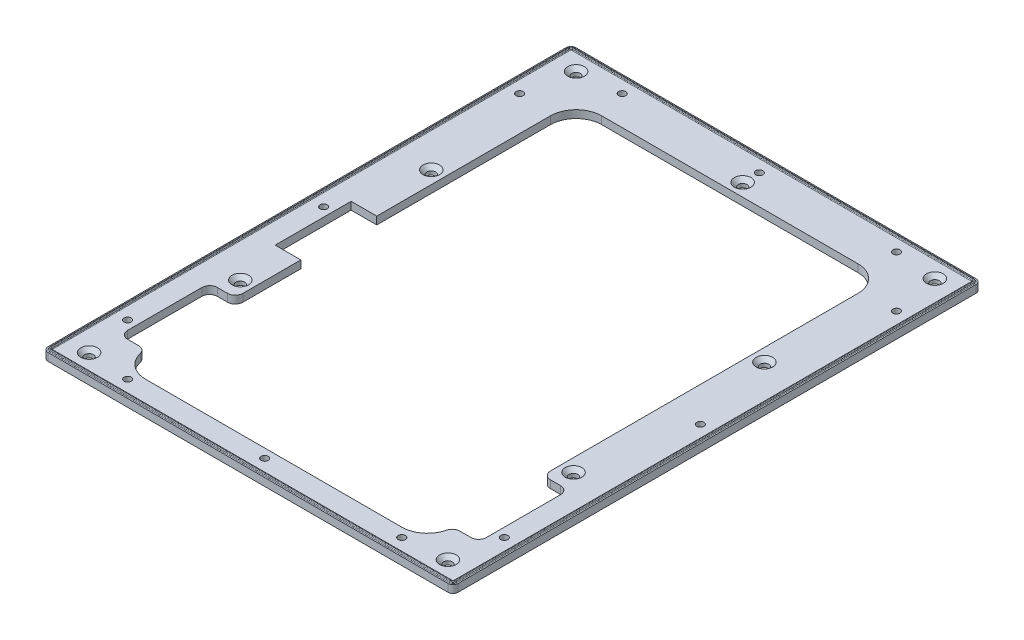
from build123d import *

# Parameters (mm, degrees)
BOSS_EXTRUDE1_DEPTH                            = 3
CSK_FOR_M3_FLAT_HEAD_MACHINE_SCREW1_AT_2_COUNT = 2
CSK_FOR_M3_FLAT_HEAD_MACHINE_SCREW1_AT_2_PITCH = 70.178344238
CSK_FOR_M3_FLAT_HEAD_MACHINE_SCREW1_AT_3_COUNT = 2
CSK_FOR_M3_FLAT_HEAD_MACHINE_SCREW1_AT_3_PITCH = 140
CSK_FOR_M3_FLAT_HEAD_MACHINE_SCREW1_AT_4_COUNT = 2
CSK_FOR_M3_FLAT_HEAD_MACHINE_SCREW1_AT_4_PITCH = 148.348407474
CSK_FOR_M3_FLAT_HEAD_MACHINE_SCREW1_AT_5_COUNT = 2
CSK_FOR_M3_FLAT_HEAD_MACHINE_SCREW1_AT_5_PITCH = 61.702917273
CSK_FOR_M3_FLAT_HEAD_MACHINE_SCREW1_AT_6_COUNT = 2
CSK_FOR_M3_FLAT_HEAD_MACHINE_SCREW1_AT_6_PITCH = 136.091880728
CSK_FOR_M3_FLAT_HEAD_MACHINE_SCREW1_AT_7_COUNT = 2
CSK_FOR_M3_FLAT_HEAD_MACHINE_SCREW1_AT_7_PITCH = 190
CSK_FOR_M3_FLAT_HEAD_MACHINE_SCREW1_AT_8_COUNT = 2
CSK_FOR_M3_FLAT_HEAD_MACHINE_SCREW1_AT_8_PITCH = 236.008474424
CSK_FOR_M3_FLAT_HEAD_MACHINE_SCREW1_AT_9_COUNT = 2
CSK_FOR_M3_FLAT_HEAD_MACHINE_SCREW1_AT_9_PITCH = 191.627242322
CUT_EXTRUDE8_DEPTH                             = 261.854365499
SKETCH15_W                                     = 10
SKETCH15_H                                     = 35
CUT_EXTRUDE9_DEPTH                             = 261.854365499
FILLET5_R                                      = 3
BOSS_EXTRUDE2_DEPTH                            = 0.5
FILLET6_R                                      = 0.25
F_3_0MM_DOWEL_HOLE1_D                          = 2.8
F_3_0MM_DOWEL_HOLE1_ON_FACE_2_D                = 2.8
F_3_0MM_DOWEL_HOLE1_ON_FACE_3_D                = 2.8
SKETCH22_W                                     = 10
SKETCH22_H                                     = 29.612304697
CUT_EXTRUDE10_DEPTH                            = 261.854365499


with BuildPart() as part:
    # Sketch1 → Boss-Extrude1 (new body)
    with BuildSketch(Plane(origin=(0, 0, 0), x_dir=(1, 0, 0), z_dir=(0, 1, 0))):
        with BuildLine():
            Line((2, 0), (158, 0))
            ThreePointArc((158, 0), (159.414213562, -0.585786438), (160, -2))
            Line((160, -2), (160, -204))
            ThreePointArc((160, -204), (159.414213562, -205.414213562), (158, -206))
            Line((158, -206), (2, -206))
            ThreePointArc((2, -206), (0.585786438, -205.414213562), (0, -204))
            Line((0, -204), (0, -2))
            ThreePointArc((0, -2), (0.585786438, -0.585786438), (2, 0))
        make_face()
    extrude(amount=BOSS_EXTRUDE1_DEPTH)

    # Sketch13 → CSK for M3 Flat Head Machine Screw1 (revolve, cut)
    with BuildSketch(Plane(origin=(10, 3, 8), x_dir=(0, 0, 1), z_dir=(1, 0, 0))):
        Polygon((0, 0), (0, 3), (1.7, 3), (1.7, 1.55), (3.25, 0), align=None)
    csk_for_m3_flat_head_machine_screw1 = revolve(axis=Axis((10, 9.35, 8), (0, -1, 0)), mode=Mode.SUBTRACT)

    # CSK for M3 Flat Head Machine Screw1 at 2: CSK for M3 Flat Head Machine Screw1 ×2
    with Locations(*[Vector(0.9974586998307351, 0, 0.07124704998790932) * (i * CSK_FOR_M3_FLAT_HEAD_MACHINE_SCREW1_AT_2_PITCH) for i in range(1, CSK_FOR_M3_FLAT_HEAD_MACHINE_SCREW1_AT_2_COUNT)]):
        add(csk_for_m3_flat_head_machine_screw1, mode=Mode.SUBTRACT)

    # CSK for M3 Flat Head Machine Screw1 at 3: CSK for M3 Flat Head Machine Screw1 ×2
    with Locations(*[(i * CSK_FOR_M3_FLAT_HEAD_MACHINE_SCREW1_AT_3_PITCH, 0, 0) for i in range(1, CSK_FOR_M3_FLAT_HEAD_MACHINE_SCREW1_AT_3_COUNT)]):
        add(csk_for_m3_flat_head_machine_screw1, mode=Mode.SUBTRACT)

    # CSK for M3 Flat Head Machine Screw1 at 4: CSK for M3 Flat Head Machine Screw1 ×2
    with Locations(*[Vector(0.9100198802193487, 0, 0.41456461209992634) * (i * CSK_FOR_M3_FLAT_HEAD_MACHINE_SCREW1_AT_4_PITCH) for i in range(1, CSK_FOR_M3_FLAT_HEAD_MACHINE_SCREW1_AT_4_COUNT)]):
        add(csk_for_m3_flat_head_machine_screw1, mode=Mode.SUBTRACT)

    # CSK for M3 Flat Head Machine Screw1 at 5: CSK for M3 Flat Head Machine Screw1 ×2
    with Locations(*[Vector(0.08103344575876159, 0, 0.9967113828327947) * (i * CSK_FOR_M3_FLAT_HEAD_MACHINE_SCREW1_AT_5_PITCH) for i in range(1, CSK_FOR_M3_FLAT_HEAD_MACHINE_SCREW1_AT_5_COUNT)]):
        add(csk_for_m3_flat_head_machine_screw1, mode=Mode.SUBTRACT)

    # CSK for M3 Flat Head Machine Screw1 at 6: CSK for M3 Flat Head Machine Screw1 ×2
    with Locations(*[Vector(0.036739884651930246, 0, 0.9993248625325815) * (i * CSK_FOR_M3_FLAT_HEAD_MACHINE_SCREW1_AT_6_PITCH) for i in range(1, CSK_FOR_M3_FLAT_HEAD_MACHINE_SCREW1_AT_6_COUNT)]):
        add(csk_for_m3_flat_head_machine_screw1, mode=Mode.SUBTRACT)

    # CSK for M3 Flat Head Machine Screw1 at 7: CSK for M3 Flat Head Machine Screw1 ×2
    with Locations(*[(0, 0, i * CSK_FOR_M3_FLAT_HEAD_MACHINE_SCREW1_AT_7_PITCH) for i in range(1, CSK_FOR_M3_FLAT_HEAD_MACHINE_SCREW1_AT_7_COUNT)]):
        add(csk_for_m3_flat_head_machine_screw1, mode=Mode.SUBTRACT)

    # CSK for M3 Flat Head Machine Screw1 at 8: CSK for M3 Flat Head Machine Screw1 ×2
    with Locations(*[Vector(0.5931990380498493, 0, 0.8050558373533686) * (i * CSK_FOR_M3_FLAT_HEAD_MACHINE_SCREW1_AT_8_PITCH) for i in range(1, CSK_FOR_M3_FLAT_HEAD_MACHINE_SCREW1_AT_8_COUNT)]):
        add(csk_for_m3_flat_head_machine_screw1, mode=Mode.SUBTRACT)

    # CSK for M3 Flat Head Machine Screw1 at 9: CSK for M3 Flat Head Machine Screw1 ×2
    with Locations(*[Vector(0.7044927347701055, 0, 0.7097111994721077) * (i * CSK_FOR_M3_FLAT_HEAD_MACHINE_SCREW1_AT_9_PITCH) for i in range(1, CSK_FOR_M3_FLAT_HEAD_MACHINE_SCREW1_AT_9_COUNT)]):
        add(csk_for_m3_flat_head_machine_screw1, mode=Mode.SUBTRACT)

    # Sketch14 → Cut-Extrude8 (cut, through all)
    with BuildSketch(Plane(origin=(0, 3, 0), x_dir=(1, 0, 0), z_dir=(0, 1, 0))):
        with BuildLine():
            Line((30, -18), (130, -18))
            ThreePointArc((130, -18), (137.071067812, -20.928932188), (140, -28))
            Line((140, -28), (140, -186))
            ThreePointArc((140, -186), (137.071067812, -193.071067812), (130, -196))
            Line((130, -196), (30, -196))
            ThreePointArc((30, -196), (22.928932188, -193.071067812), (20, -186))
            Line((20, -186), (20, -28))
            ThreePointArc((20, -28), (22.928932188, -20.928932188), (30, -18))
        make_face()
    extrude(amount=-CUT_EXTRUDE8_DEPTH, mode=Mode.SUBTRACT)

    # Sketch15 → Cut-Extrude9 (cut, through all)
    with BuildSketch(Plane(origin=(0, 3, 0), x_dir=(1, 0, 0), z_dir=(0, 1, 0))):
        with Locations((15, -168.5)):
            Rectangle(SKETCH15_W, SKETCH15_H)
        with Locations((145, -168.5)):
            Rectangle(SKETCH15_W, SKETCH15_H)
    extrude(amount=-CUT_EXTRUDE9_DEPTH, mode=Mode.SUBTRACT)

    # Fillet5
    fillet5_edges = [part.edges().sort_by_distance(p)[0] for p in [
        (20, 1.5, 186),
        (140, 1.5, 186),
        (20, 1.5, 151),
        (10, 1.5, 186),
        (10, 1.5, 151),
        (140, 1.5, 151),
        (150, 1.5, 151),
        (150, 1.5, 186),
    ]]
    fillet(fillet5_edges, radius=FILLET5_R)

    # Sketch18 → Boss-Extrude2 (add)
    with BuildSketch(Plane(origin=(0, 3, 0), x_dir=(1, 0, 0), z_dir=(0, 1, 0))):
        with BuildLine():
            Line((2, -205.25), (158, -205.25))
            ThreePointArc((158, -205.25), (158.883883476, -204.883883476), (159.25, -204))
            Line((159.25, -204), (159.25, -2))
            ThreePointArc((159.25, -2), (158.883883476, -1.116116524), (158, -0.75))
            Line((158, -0.75), (2, -0.75))
            ThreePointArc((2, -0.75), (1.116116524, -1.116116524), (0.75, -2))
            Line((0.75, -2), (0.75, -204))
            ThreePointArc((0.75, -204), (1.116116524, -204.883883476), (2, -205.25))
        make_face()
        with BuildLine():
            Line((2, -204.5), (158, -204.5))
            ThreePointArc((158, -204.5), (158.353553391, -204.353553391), (158.5, -204))
            Line((158.5, -204), (158.5, -2))
            ThreePointArc((158.5, -2), (158.353553391, -1.646446609), (158, -1.5))
            Line((158, -1.5), (2, -1.5))
            ThreePointArc((2, -1.5), (1.646446609, -1.646446609), (1.5, -2))
            Line((1.5, -2), (1.5, -204))
            ThreePointArc((1.5, -204), (1.646446609, -204.353553391), (2, -204.5))
        make_face(mode=Mode.SUBTRACT)
    extrude(amount=BOSS_EXTRUDE2_DEPTH)

    # Fillet6
    fillet6_edges = [part.edges().sort_by_distance(p)[0] for p in [
        (1.116116524, 3, 1.116116524),
        (80, 3, 0.75),
        (158.883883476, 3, 1.116116524),
        (159.25, 3, 103),
        (158.883883476, 3, 204.883883476),
        (80, 3, 205.25),
        (1.116116524, 3, 204.883883476),
        (158.353553391, 3, 1.646446609),
        (158.5, 3, 103),
        (158.353553391, 3, 204.353553391),
        (80, 3, 204.5),
        (1.646446609, 3, 204.353553391),
        (1.5, 3, 103),
        (1.646446609, 3, 1.646446609),
        (0.75, 3, 103),
        (80, 3, 1.5),
    ]]
    fillet(fillet6_edges, radius=FILLET6_R)
    fillet6_2_edges = [part.edges().sort_by_distance(p)[0] for p in [
        (80, 3.5, 1.5),
        (158.353553391, 3.5, 1.646446609),
        (158.5, 3.5, 103),
        (158.353553391, 3.5, 204.353553391),
        (80, 3.5, 204.5),
        (1.646446609, 3.5, 204.353553391),
        (1.5, 3.5, 103),
        (80, 3.5, 0.75),
        (158.883883476, 3.5, 1.116116524),
        (159.25, 3.5, 103),
        (158.883883476, 3.5, 204.883883476),
        (80, 3.5, 205.25),
        (1.116116524, 3.5, 204.883883476),
        (0.75, 3.5, 103),
        (1.646446609, 3.5, 1.646446609),
        (1.116116524, 3.5, 1.116116524),
    ]]
    fillet(fillet6_2_edges, radius=FILLET6_R - 0.0001)  # a hair under: the kernel refuses the full size

    # Ø3.0mm Dowel Hole1 (through all)
    with Locations(Plane(origin=(133.5, 3, 6.5), x_dir=(0, 0, -1), z_dir=(0, -1, 0))):
        with Locations((0, 0)):
            Hole(F_3_0MM_DOWEL_HOLE1_D / 2)

    # Ø3.0mm Dowel Hole1 on face 2 (through all)
    with Locations(Plane(origin=(80, 8.5, 6.5), x_dir=(0, 0, -1), z_dir=(0, -1, 0))):
        with Locations((0, 0), (-20, -73.5), (-96.5, -73.5), (-173, -73.5), (-193, 0), (-173, 73.5), (-96.5, 73.5), (0, 53.5), (-20, 73.5), (0, -53.5), (-193, -53.5), (-193, 53.5)):
            Hole(F_3_0MM_DOWEL_HOLE1_ON_FACE_2_D / 2)

    # Ø3.0mm Dowel Hole1 on face 3 (through all)
    with Locations(Plane(origin=(26.5, 3, 6.5), x_dir=(0, 0, 1), z_dir=(0, 1, 0))):
        with Locations((0, 0), (193, 0), (193, 107), (20, 127)):
            Hole(F_3_0MM_DOWEL_HOLE1_ON_FACE_3_D / 2)

    # Sketch22 → Cut-Extrude10 (cut, through all)
    with BuildSketch(Plane(origin=(0, 3, 0), x_dir=(1, 0, 0), z_dir=(0, 1, 0))):
        with Locations((15, -110.583459859)):
            Rectangle(SKETCH22_W, SKETCH22_H)
    extrude(amount=-CUT_EXTRUDE10_DEPTH, mode=Mode.SUBTRACT)


solid = part.part
